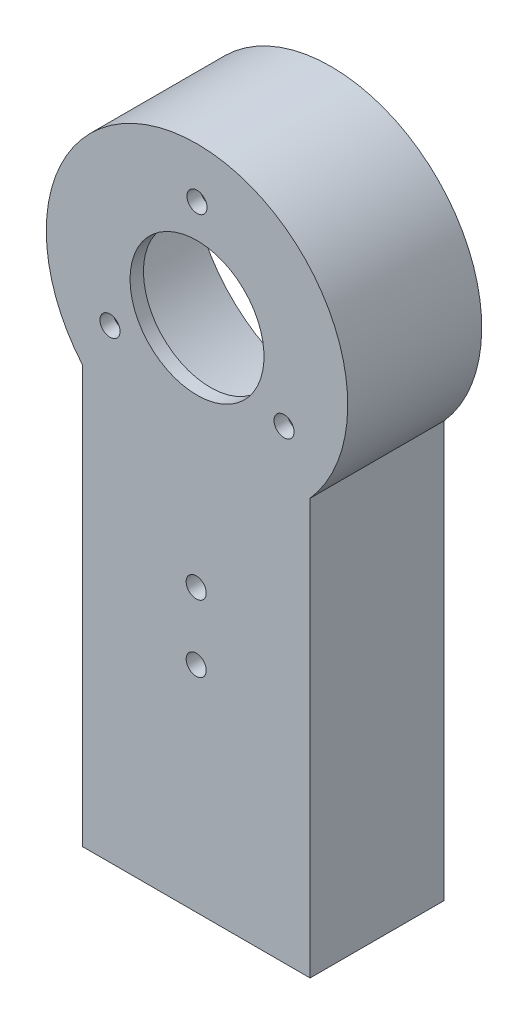
from build123d import *

# Parameters (mm, degrees)
SKETCH1_R           = 1.5
BOSS_EXTRUDE1_DEPTH = 20
SKETCH2_R           = 10
CUT_EXTRUDE1_DEPTH  = 20
SKETCH3_R           = 1.5
CUT_EXTRUDE2_DEPTH  = 20
SKETCH4_R           = 21
CUT_EXTRUDE3_DEPTH  = 18
SKETCH5_R           = 1.5
CUT_EXTRUDE4_DEPTH  = 15


with BuildPart() as part:
    # Sketch1 → Boss-Extrude1 (new body)
    with BuildSketch(Plane.XY):
        with BuildLine():
            Line((16.876374486, -76.9), (16.876374486, -14.880792459))
            ThreePointArc((16.876374486, -14.880792459), (0.188725707, 22.499208488), (-17.123625514, -14.595596913))
            Line((-17.123625514, -14.595596913), (-17.123625514, -76.9))
            Line((-17.123625514, -76.9), (16.876374486, -76.9))
        make_face()
        with Locations((-0.123625514, -44.9)):
            Circle(SKETCH1_R, mode=Mode.SUBTRACT)
        with Locations((-0.123625514, -34.9)):
            Circle(SKETCH1_R, mode=Mode.SUBTRACT)
    extrude(amount=BOSS_EXTRUDE1_DEPTH)

    # Sketch2 → Cut-Extrude1 (cut)
    with BuildSketch(Plane(origin=(0, 0, 0), x_dir=(-1, 0, 0), z_dir=(0, 0, -1))):
        Circle(SKETCH2_R)
    extrude(amount=-CUT_EXTRUDE1_DEPTH, mode=Mode.SUBTRACT)

    # Sketch3 → Cut-Extrude2 (cut)
    with BuildSketch(Plane(origin=(0, 0, 0), x_dir=(-1, 0, 0), z_dir=(0, 0, -1))):
        with Locations((0, 15)):
            Circle(SKETCH3_R)
        with Locations((12.990381057, -7.5)):
            Circle(SKETCH3_R)
        with Locations((-12.990381057, -7.5)):
            Circle(SKETCH3_R)
    extrude(amount=-CUT_EXTRUDE2_DEPTH, mode=Mode.SUBTRACT)

    # Sketch4 → Cut-Extrude3 (cut)
    with BuildSketch(Plane(origin=(0, 0, 0), x_dir=(-1, 0, 0), z_dir=(0, 0, -1))):
        Circle(SKETCH4_R)
    extrude(amount=-CUT_EXTRUDE3_DEPTH, mode=Mode.SUBTRACT)

    # Sketch5 → Cut-Extrude4 (cut)
    with BuildSketch(Plane.XZ.offset(76.9)):
        with Locations((-7.123625514, 10)):
            Circle(SKETCH5_R)
        with Locations((6.876374486, 10)):
            Circle(SKETCH5_R)
    extrude(amount=-CUT_EXTRUDE4_DEPTH, mode=Mode.SUBTRACT)


solid = part.part
